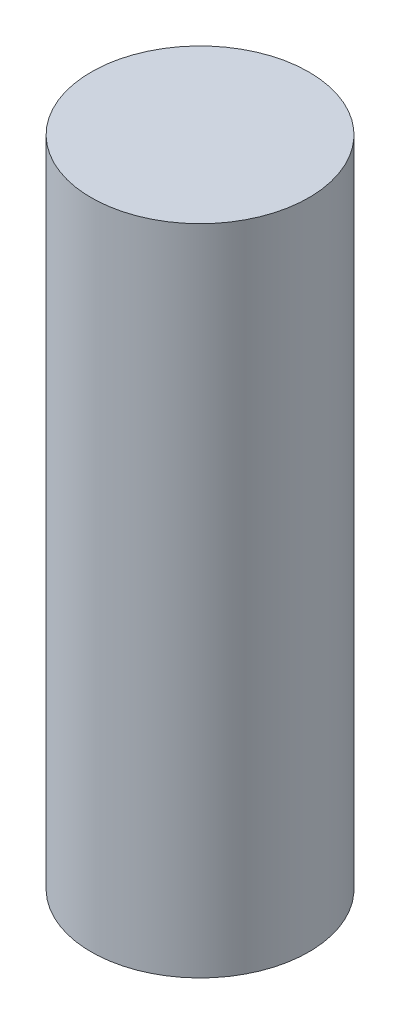
from build123d import *

# Parameters (mm, degrees)
SKETCH1_R           = 3.175
BOSS_EXTRUDE1_DEPTH = 19.05


with BuildPart() as part:
    # Sketch1 → Boss-Extrude1 (new body)
    with BuildSketch(Plane(origin=(0, 0, 0), x_dir=(1, 0, 0), z_dir=(0, 1, 0))):
        Circle(SKETCH1_R)
    extrude(amount=BOSS_EXTRUDE1_DEPTH)


solid = part.part
